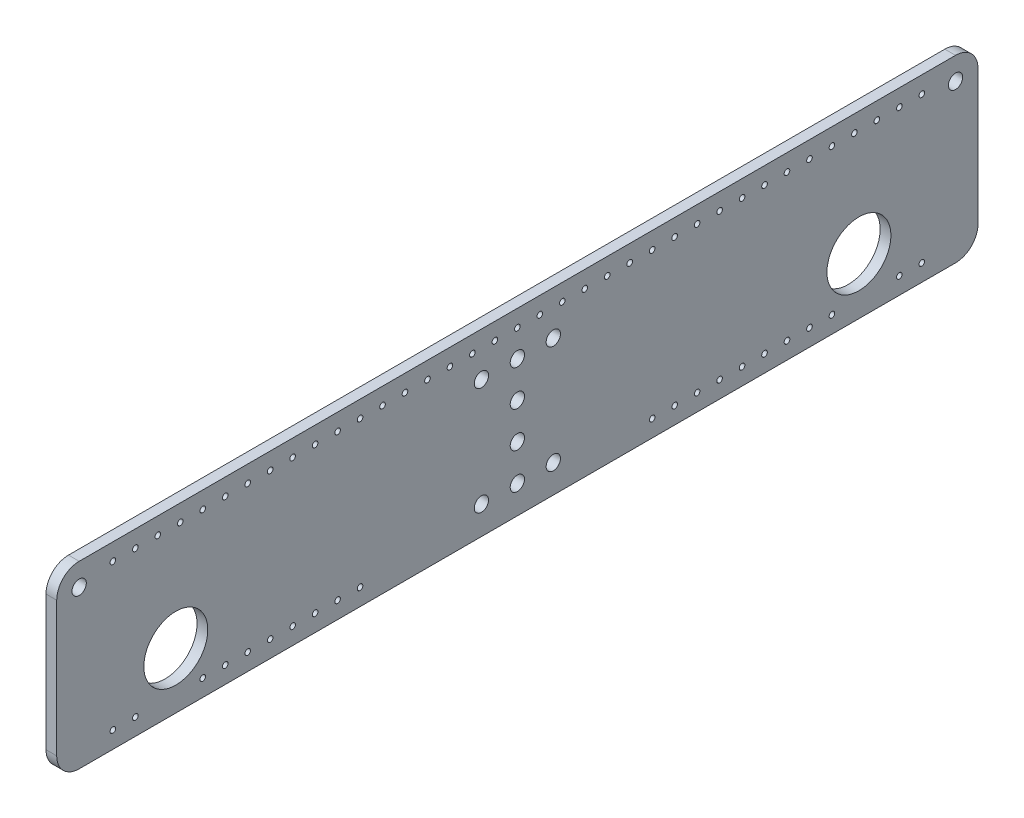
from build123d import *

# Parameters (mm, degrees)
SKETCH2_R           = 14.225
SKETCH2_R_2         = 3.18
SKETCH2_R_3         = 1.25
BOSS_EXTRUDE1_DEPTH = 4.7625


with BuildPart() as part:
    # Sketch2 → Boss-Extrude1 (new body)
    with BuildSketch(Plane(origin=(0, 0, 0), x_dir=(0, 0, -1), z_dir=(1, 0, 0))):
        with BuildLine():
            Line((-23.472321429, 28.668303571), (-23.472321429, -31.331696429))
            ThreePointArc((-23.472321429, -31.331696429), (-20.54338924, -38.40276424), (-13.472321429, -41.331696429))
            Line((-13.472321429, -41.331696429), (376.527678571, -41.331696429))
            ThreePointArc((376.527678571, -41.331696429), (383.598746383, -38.40276424), (386.527678571, -31.331696429))
            Line((386.527678571, -31.331696429), (386.527678571, 28.668303571))
            ThreePointArc((386.527678571, 28.668303571), (383.598746383, 35.739371383), (376.527678571, 38.668303571))
            Line((376.527678571, 38.668303571), (-13.472321429, 38.668303571))
            ThreePointArc((-13.472321429, 38.668303571), (-20.54338924, 35.739371383), (-23.472321429, 28.668303571))
        make_face()
        with Locations((29.527678571, -16.331696429)):
            Circle(SKETCH2_R, mode=Mode.SUBTRACT)
        with Locations((333.527678571, -16.331696429)):
            Circle(SKETCH2_R, mode=Mode.SUBTRACT)
        with Locations((181.527678571, -28.771696429)):
            Circle(SKETCH2_R_2, mode=Mode.SUBTRACT)
        with Locations((197.527678571, -28.771696429)):
            Circle(SKETCH2_R_2, mode=Mode.SUBTRACT)
        with Locations((197.527678571, 19.228303571)):
            Circle(SKETCH2_R_2, mode=Mode.SUBTRACT)
        with Locations((181.527678571, -12.771696429)):
            Circle(SKETCH2_R_2, mode=Mode.SUBTRACT)
        with Locations((181.527678571, 3.228303571)):
            Circle(SKETCH2_R_2, mode=Mode.SUBTRACT)
        with Locations((181.527678571, 19.228303571)):
            Circle(SKETCH2_R_2, mode=Mode.SUBTRACT)
        with Locations((165.527678571, -28.771696429)):
            Circle(SKETCH2_R_2, mode=Mode.SUBTRACT)
        with Locations((165.527678571, 19.228303571)):
            Circle(SKETCH2_R_2, mode=Mode.SUBTRACT)
        with Locations((1.527678571, 31.168303571)):
            Circle(SKETCH2_R_3, mode=Mode.SUBTRACT)
        with Locations((11.527678571, 31.168303571)):
            Circle(SKETCH2_R_3, mode=Mode.SUBTRACT)
        with Locations((21.527678571, 31.168303571)):
            Circle(SKETCH2_R_3, mode=Mode.SUBTRACT)
        with Locations((31.527678571, 31.168303571)):
            Circle(SKETCH2_R_3, mode=Mode.SUBTRACT)
        with Locations((41.527678571, 31.168303571)):
            Circle(SKETCH2_R_3, mode=Mode.SUBTRACT)
        with Locations((51.527678571, 31.168303571)):
            Circle(SKETCH2_R_3, mode=Mode.SUBTRACT)
        with Locations((61.527678571, 31.168303571)):
            Circle(SKETCH2_R_3, mode=Mode.SUBTRACT)
        with Locations((71.527678571, 31.168303571)):
            Circle(SKETCH2_R_3, mode=Mode.SUBTRACT)
        with Locations((81.527678571, 31.168303571)):
            Circle(SKETCH2_R_3, mode=Mode.SUBTRACT)
        with Locations((91.527678571, 31.168303571)):
            Circle(SKETCH2_R_3, mode=Mode.SUBTRACT)
        with Locations((101.527678571, 31.168303571)):
            Circle(SKETCH2_R_3, mode=Mode.SUBTRACT)
        with Locations((111.527678571, 31.168303571)):
            Circle(SKETCH2_R_3, mode=Mode.SUBTRACT)
        with Locations((121.527678571, 31.168303571)):
            Circle(SKETCH2_R_3, mode=Mode.SUBTRACT)
        with Locations((131.527678571, 31.168303571)):
            Circle(SKETCH2_R_3, mode=Mode.SUBTRACT)
        with Locations((141.527678571, 31.168303571)):
            Circle(SKETCH2_R_3, mode=Mode.SUBTRACT)
        with Locations((151.527678571, 31.168303571)):
            Circle(SKETCH2_R_3, mode=Mode.SUBTRACT)
        with Locations((161.527678571, 31.168303571)):
            Circle(SKETCH2_R_3, mode=Mode.SUBTRACT)
        with Locations((171.527678571, 31.168303571)):
            Circle(SKETCH2_R_3, mode=Mode.SUBTRACT)
        with Locations((181.527678571, 31.168303571)):
            Circle(SKETCH2_R_3, mode=Mode.SUBTRACT)
        with Locations((191.527678571, 31.168303571)):
            Circle(SKETCH2_R_3, mode=Mode.SUBTRACT)
        with Locations((201.527678571, 31.168303571)):
            Circle(SKETCH2_R_3, mode=Mode.SUBTRACT)
        with Locations((211.527678571, 31.168303571)):
            Circle(SKETCH2_R_3, mode=Mode.SUBTRACT)
        with Locations((221.527678571, 31.168303571)):
            Circle(SKETCH2_R_3, mode=Mode.SUBTRACT)
        with Locations((231.527678571, 31.168303571)):
            Circle(SKETCH2_R_3, mode=Mode.SUBTRACT)
        with Locations((241.527678571, 31.168303571)):
            Circle(SKETCH2_R_3, mode=Mode.SUBTRACT)
        with Locations((251.527678571, 31.168303571)):
            Circle(SKETCH2_R_3, mode=Mode.SUBTRACT)
        with Locations((261.527678571, 31.168303571)):
            Circle(SKETCH2_R_3, mode=Mode.SUBTRACT)
        with Locations((271.527678571, 31.168303571)):
            Circle(SKETCH2_R_3, mode=Mode.SUBTRACT)
        with Locations((281.527678571, 31.168303571)):
            Circle(SKETCH2_R_3, mode=Mode.SUBTRACT)
        with Locations((291.527678571, 31.168303571)):
            Circle(SKETCH2_R_3, mode=Mode.SUBTRACT)
        with Locations((301.527678571, 31.168303571)):
            Circle(SKETCH2_R_3, mode=Mode.SUBTRACT)
        with Locations((311.527678571, 31.168303571)):
            Circle(SKETCH2_R_3, mode=Mode.SUBTRACT)
        with Locations((321.527678571, 31.168303571)):
            Circle(SKETCH2_R_3, mode=Mode.SUBTRACT)
        with Locations((331.527678571, 31.168303571)):
            Circle(SKETCH2_R_3, mode=Mode.SUBTRACT)
        with Locations((341.527678571, 31.168303571)):
            Circle(SKETCH2_R_3, mode=Mode.SUBTRACT)
        with Locations((351.527678571, 31.168303571)):
            Circle(SKETCH2_R_3, mode=Mode.SUBTRACT)
        with Locations((361.527678571, 31.168303571)):
            Circle(SKETCH2_R_3, mode=Mode.SUBTRACT)
        with Locations((1.527678571, -33.831696429)):
            Circle(SKETCH2_R_3, mode=Mode.SUBTRACT)
        with Locations((11.527678571, -33.831696429)):
            Circle(SKETCH2_R_3, mode=Mode.SUBTRACT)
        with Locations((41.527678571, -33.831696429)):
            Circle(SKETCH2_R_3, mode=Mode.SUBTRACT)
        with Locations((51.527678571, -33.831696429)):
            Circle(SKETCH2_R_3, mode=Mode.SUBTRACT)
        with Locations((61.527678571, -33.831696429)):
            Circle(SKETCH2_R_3, mode=Mode.SUBTRACT)
        with Locations((71.527678571, -33.831696429)):
            Circle(SKETCH2_R_3, mode=Mode.SUBTRACT)
        with Locations((81.527678571, -33.831696429)):
            Circle(SKETCH2_R_3, mode=Mode.SUBTRACT)
        with Locations((91.527678571, -33.831696429)):
            Circle(SKETCH2_R_3, mode=Mode.SUBTRACT)
        with Locations((101.527678571, -33.831696429)):
            Circle(SKETCH2_R_3, mode=Mode.SUBTRACT)
        with Locations((111.527678571, -33.831696429)):
            Circle(SKETCH2_R_3, mode=Mode.SUBTRACT)
        with Locations((241.527678571, -33.831696429)):
            Circle(SKETCH2_R_3, mode=Mode.SUBTRACT)
        with Locations((251.527678571, -33.831696429)):
            Circle(SKETCH2_R_3, mode=Mode.SUBTRACT)
        with Locations((261.527678571, -33.831696429)):
            Circle(SKETCH2_R_3, mode=Mode.SUBTRACT)
        with Locations((271.527678571, -33.831696429)):
            Circle(SKETCH2_R_3, mode=Mode.SUBTRACT)
        with Locations((281.527678571, -33.831696429)):
            Circle(SKETCH2_R_3, mode=Mode.SUBTRACT)
        with Locations((291.527678571, -33.831696429)):
            Circle(SKETCH2_R_3, mode=Mode.SUBTRACT)
        with Locations((301.527678571, -33.831696429)):
            Circle(SKETCH2_R_3, mode=Mode.SUBTRACT)
        with Locations((311.527678571, -33.831696429)):
            Circle(SKETCH2_R_3, mode=Mode.SUBTRACT)
        with Locations((321.527678571, -33.831696429)):
            Circle(SKETCH2_R_3, mode=Mode.SUBTRACT)
        with Locations((351.527678571, -33.831696429)):
            Circle(SKETCH2_R_3, mode=Mode.SUBTRACT)
        with Locations((361.527678571, -33.831696429)):
            Circle(SKETCH2_R_3, mode=Mode.SUBTRACT)
        with Locations((-13.472321429, 28.668303571)):
            Circle(SKETCH2_R_2, mode=Mode.SUBTRACT)
        with Locations((376.527678571, 28.668303571)):
            Circle(SKETCH2_R_2, mode=Mode.SUBTRACT)
    extrude(amount=BOSS_EXTRUDE1_DEPTH)


solid = part.part
